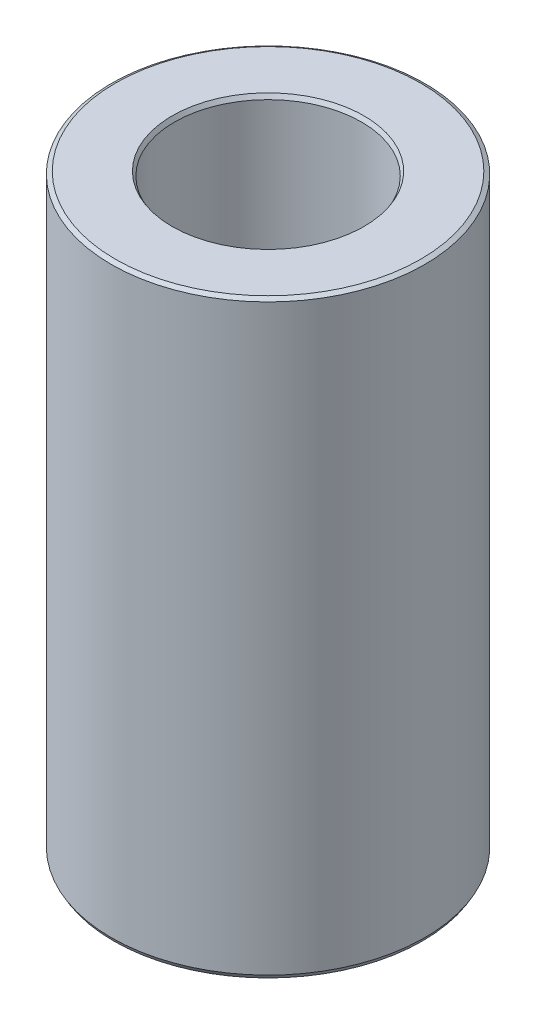
from build123d import *
from OCP.BRepFilletAPI import BRepFilletAPI_MakeChamfer

# Parameters (mm, degrees)
SKETCH1_R           = 45
BOSS_EXTRUDE1_DEPTH = 169.229643277
SKETCH2_R           = 26.843349646
CUT_EXTRUDE1_DEPTH  = 181.800088948
CHAMFER1_SIZE       = 0.691521514
CHAMFER1_SIZE2      = 1.197750396


with BuildPart() as part:
    # Sketch1 → Boss-Extrude1 (new body)
    with BuildSketch(Plane(origin=(0, 0, 0), x_dir=(1, 0, 0), z_dir=(0, 1, 0))):
        Circle(SKETCH1_R)
    extrude(amount=BOSS_EXTRUDE1_DEPTH)

    # Sketch2 → Cut-Extrude1 (cut, through all)
    with BuildSketch(Plane(origin=(0, 0, 0), x_dir=(1, 0, 0), z_dir=(0, 1, 0))):
        Circle(SKETCH2_R)
    extrude(amount=CUT_EXTRUDE1_DEPTH, mode=Mode.SUBTRACT)

    # Chamfer1: one chamfer whose edges measure the first distance from different faces: ONE call of the kernel's chamfer builder (chamfer() names one face for all edges)
    chamfer1_edges_1 = [part.edges().sort_by_distance(p)[0] for p in [
        (-26.843349646, 169.229643277, 0),
    ]]
    chamfer1_side_1 = [part.faces().sort_by_distance(p)[0] for p in [
        (-43.727207794, 169.229643277, 0),
    ]]
    chamfer1_edges_2 = [part.edges().sort_by_distance(p)[0] for p in [
        (-26.843349646, 0, 0),
    ]]
    chamfer1_side_2 = [part.faces().sort_by_distance(p)[0] for p in [
        (-26.843349646, 84.614821639, 0),
    ]]
    chamfer1_edges_3 = [part.edges().sort_by_distance(p)[0] for p in [
        (-45, 0, 0),
    ]]
    chamfer1_side_3 = [part.faces().sort_by_distance(p)[0] for p in [
        (-43.727207794, 0, 0),
    ]]
    chamfer1_edges_4 = [part.edges().sort_by_distance(p)[0] for p in [
        (-45, 169.229643277, 0),
    ]]
    chamfer1_side_4 = [part.faces().sort_by_distance(p)[0] for p in [
        (-45, 84.614821639, 0),
    ]]
    chamfer1 = BRepFilletAPI_MakeChamfer(part.part.solid().wrapped)
    for e in chamfer1_edges_1:
        chamfer1.Add(CHAMFER1_SIZE, CHAMFER1_SIZE2, e.wrapped, chamfer1_side_1[0].wrapped)  # the first distance lies on this face
    for e in chamfer1_edges_2:
        chamfer1.Add(CHAMFER1_SIZE, CHAMFER1_SIZE2, e.wrapped, chamfer1_side_2[0].wrapped)  # the first distance lies on this face
    for e in chamfer1_edges_3:
        chamfer1.Add(CHAMFER1_SIZE, CHAMFER1_SIZE2, e.wrapped, chamfer1_side_3[0].wrapped)  # the first distance lies on this face
    for e in chamfer1_edges_4:
        chamfer1.Add(CHAMFER1_SIZE, CHAMFER1_SIZE2, e.wrapped, chamfer1_side_4[0].wrapped)  # the first distance lies on this face
    add(Compound.cast(chamfer1.Shape()), mode=Mode.REPLACE)


solid = part.part
